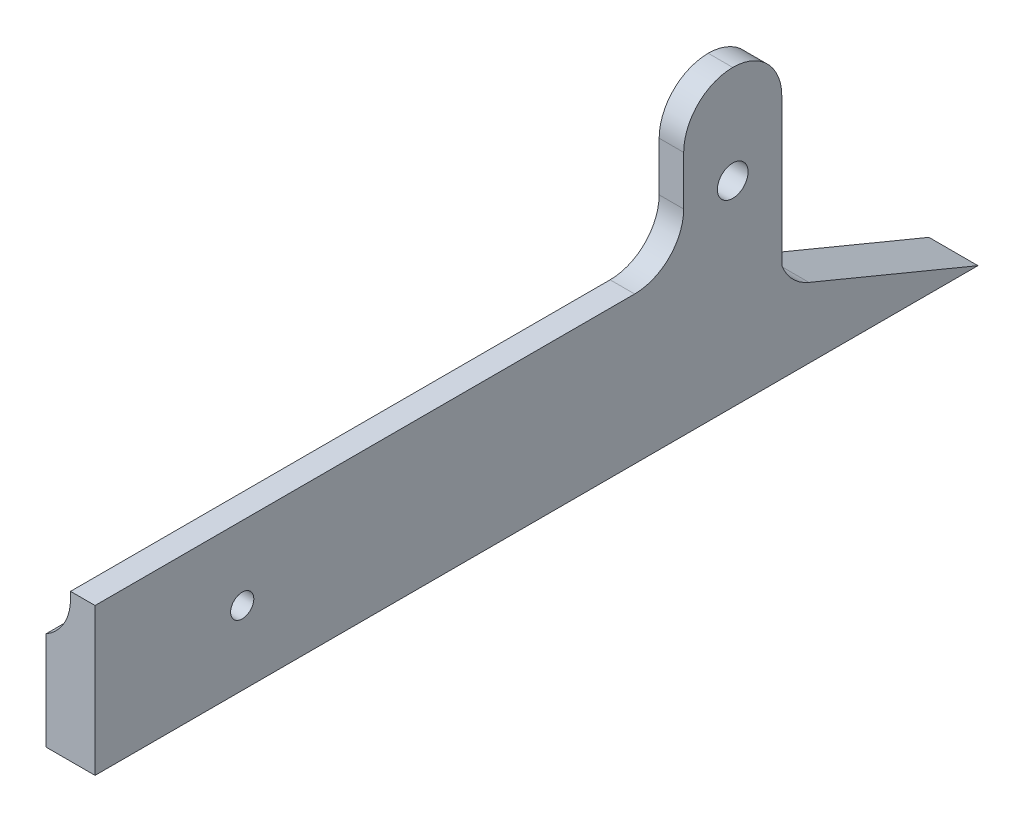
from build123d import *
from build123d.topology import SkipClean

# Parameters (mm, degrees)
BOSS_EXTRUDE1_DEPTH     = 6.35
FILLET1_R               = 12.7
BOSS_EXTRUDE2_DEPTH     = 6.35
FILLET2_R               = 12.7
CUT_EXTRUDE1_DEPTH      = 88.298066989
CUT_EXTRUDE1_DEPTH_BACK = 88.298066989
SKETCH3_R               = 3.96875
FILLET3_R               = 12.7
BOSS_EXTRUDE3_START     = 152.4
BOSS_EXTRUDE3_DEPTH     = 152.4
FILLET4_R               = 12.7
CUT_EXTRUDE2_DEPTH      = 192.450130582
CUT_EXTRUDE2_DEPTH_BACK = 192.450130582
SKETCH5_R               = 3


# Some blends are built 0.0001 mm under size
with BuildPart() as part:
    # Sketch1 → Boss-Extrude1 (new body)
    with BuildSketch(Plane(origin=(0, 0, 0), x_dir=(0, 0, -1), z_dir=(1, 0, 0))):
        Polygon((0, 14.692048969), (50.8, -6.35), (-25.4, -6.35), (-25.4, 6.35), (-25.4, 19.05), (0, 19.05), align=None)
    extrude(amount=BOSS_EXTRUDE1_DEPTH)

    # Fillet1
    # the kernel refuses this fillet: 12.7 mm, written as the material it adds along each edge
    with BuildSketch(Plane(origin=(0, 14.692048969, 0), x_dir=(0, -0.38268343236508373, -0.9238795325112893), z_dir=(1, 0, 0))) as fillet1_piece_1:
        with BuildLine():
            CenterArc((7.608898544, 12.7), FILLET1_R, 223.076533416, 46.923466584)
            Line((-1.667715659, 4.026221762), (-1.853247943, 3.852746197))
            ThreePointArc((-1.853247943, 3.852746197), (-1.068523231, 1.915909289), (-0.234665401, -0.097201592))
            Line((-0.234665401, -0.097201592), (0, -0.254))
            Line((0, -0.254), (7.608898544, -0.254))
            Line((7.608898544, -0.254), (7.608898544, 0))
        make_face()
    extrude(amount=6.35)

    # Sketch2 → Boss-Extrude2 (add)
    with SkipClean():  # the faces are left unmerged after this step: merging them gives an invalid solid
        with BuildSketch(Plane(origin=(6.35, 0, 0), x_dir=(0, 0, -1), z_dir=(1, 0, 0))):
            with BuildLine():
                Line((0, 19.05), (0, 69.85))
                Line((0, 69.85), (-25.4, 69.85))
                Line((-25.4, 69.85), (-25.4, -6.35))
                Line((-25.4, -6.35), (50.8, -6.35))
                Line((50.8, -6.35), (7.02970563, 11.780249557))
                ThreePointArc((7.02970563, 11.780249557), (2.760063939, 14.685258788), (0, 19.05))
            make_face()
        extrude(amount=BOSS_EXTRUDE2_DEPTH)

    # Fillet2
    # the kernel refuses this fillet: 12.7 mm, written as the material it adds along each edge
    with BuildSketch(Plane(origin=(6.35, 19.05, 25.4), x_dir=(-1, 0, 0), z_dir=(0, 0, -1))) as fillet2_piece_1:
        with BuildLine():
            CenterArc((12.7, 10.998522628), FILLET2_R, 180, 60)
            Line((0, 10.998522628), (0, 0))
            Line((0, 0), (6.35, 0))
        make_face()
    extrude(amount=25.4)

    # Sketch3 → Cut-Extrude1 (cut, two sides: drawn at the far end of the back side and taken through both)
    with BuildSketch(Plane(origin=(12.7, 0, 0), x_dir=(0, 0, -1), z_dir=(1, 0, 0)).offset(-CUT_EXTRUDE1_DEPTH_BACK)):
        with Locations((-12.7, 44.45)):
            Circle(SKETCH3_R)
    extrude(amount=CUT_EXTRUDE1_DEPTH + CUT_EXTRUDE1_DEPTH_BACK, mode=Mode.SUBTRACT)

    # Fillet3
    fillet3_edges = [part.edges().sort_by_distance(p)[0] for p in [
        (9.525, 69.85, 0),
        (9.525, 69.85, 25.4),
    ]]
    fillet(fillet3_edges, radius=FILLET3_R - 0.0001)  # a hair under: the kernel refuses the full size

    # Sketch4 → Boss-Extrude3 (add)
    with BuildSketch(Plane.XY.offset(25.4).offset(BOSS_EXTRUDE3_START)):
        with BuildLine():
            Line((6.35, 30.048522628), (6.35, 31.75))
            Line((6.35, 31.75), (12.7, 31.75))
            Line((12.7, 31.75), (12.7, -6.35))
            Line((12.7, -6.35), (0, -6.35))
            Line((0, -6.35), (0, 19.05))
            ThreePointArc((0, 19.05), (4.648522628, 23.698522628), (6.35, 30.048522628))
        make_face()
    extrude(amount=-BOSS_EXTRUDE3_DEPTH)

    # Fillet4
    fillet4_edges = [part.edges().sort_by_distance(p)[0] for p in [
        (9.525, 31.75, 25.4),
    ]]
    fillet(fillet4_edges, radius=FILLET4_R)

    # Sketch5 → Cut-Extrude2 (cut, two sides: drawn at the far end of the back side and taken through both)
    with SkipClean():  # the faces are left unmerged after this step: merging them gives an invalid solid
        with BuildSketch(Plane.ZY.offset(-CUT_EXTRUDE2_DEPTH_BACK)):
            with Locations((139.7, 12.7)):
                Circle(SKETCH5_R)
        extrude(amount=CUT_EXTRUDE2_DEPTH + CUT_EXTRUDE2_DEPTH_BACK, mode=Mode.SUBTRACT)


solid = part.part
